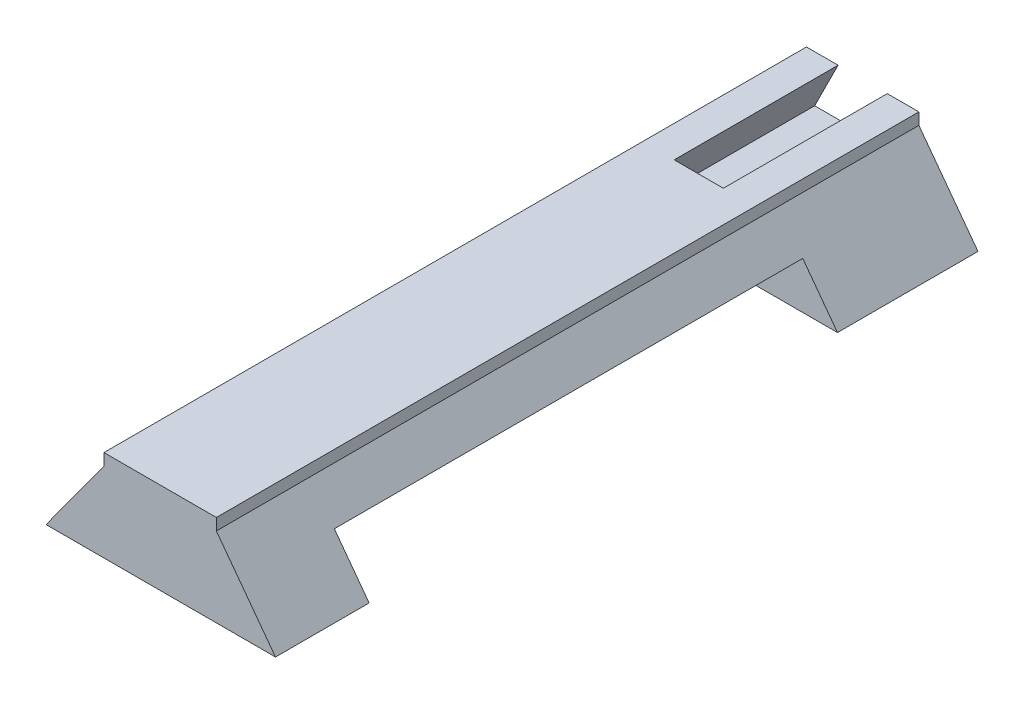
from build123d import *

# Parameters (mm, degrees)
BOSS_EXTRUDE1_DEPTH     = 30
CUT_EXTRUDE1_DEPTH      = 31.595138503
CUT_EXTRUDE1_DEPTH_BACK = 31.595138503
SKETCH3_W               = 20
SKETCH3_H               = 2
CUT_EXTRUDE2_DEPTH      = 7


with BuildPart() as part:
    # Sketch1 → Boss-Extrude1 (new body)
    with BuildSketch(Plane.XY):
        Polygon((-4.95, -3.4), (4.85, -3.4), (2.325, 0), (2.325, 0.5), (-2.475, 0.5), (-2.475, 0), align=None)
    extrude(amount=BOSS_EXTRUDE1_DEPTH)

    # Sketch3 → Cut-Extrude1 (cut, two sides: drawn at the far end of the back side and taken through both)
    with BuildSketch(Plane(origin=(0, 0, 0), x_dir=(0, 0, -1), z_dir=(1, 0, 0)).offset(-CUT_EXTRUDE1_DEPTH_BACK)):
        with Locations((-16, -2.4)):
            Rectangle(SKETCH3_W, SKETCH3_H)
    extrude(amount=CUT_EXTRUDE1_DEPTH + CUT_EXTRUDE1_DEPTH_BACK, mode=Mode.SUBTRACT)

    # Sketch4 → Cut-Extrude2 (cut)
    with BuildSketch(Plane(origin=(0, 0, 0), x_dir=(-1, 0, 0), z_dir=(0, 0, -1))):
        Polygon((-1.975, -1.5), (2.125, -1.5), (1.125, 0.5), (-0.975, 0.5), align=None)
    extrude(amount=-CUT_EXTRUDE2_DEPTH, mode=Mode.SUBTRACT)


solid = part.part
